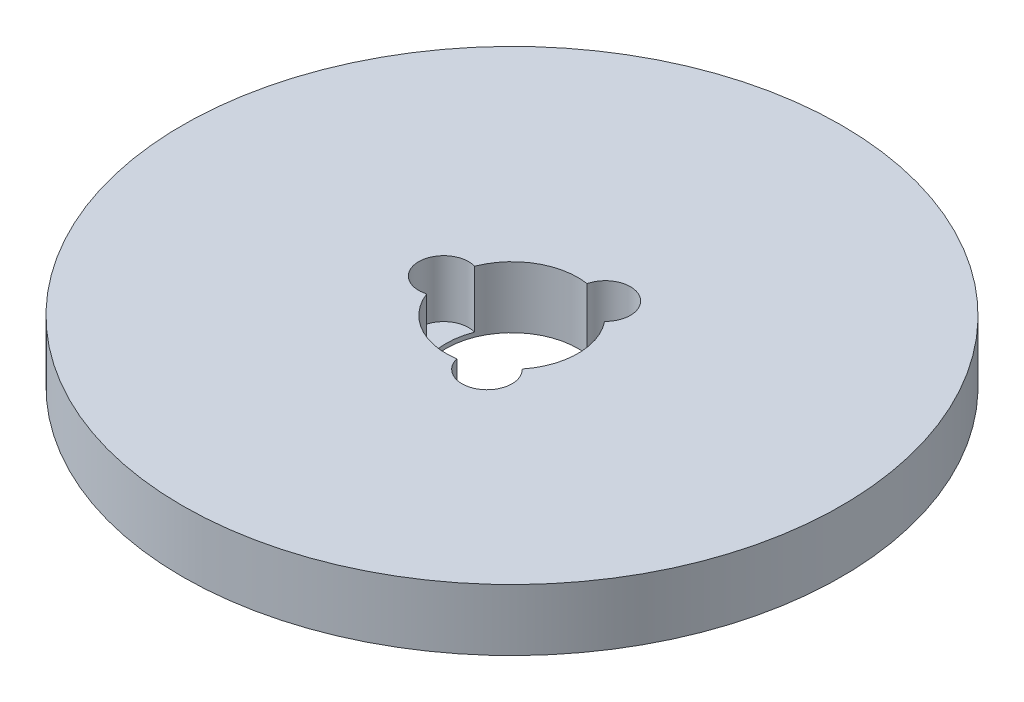
from build123d import *

# Parameters (mm, degrees)
SKETCH1_R           = 75
BOSS_EXTRUDE1_DEPTH = 14
SKETCH2_R           = 15
CUT_EXTRUDE1_DEPTH  = 107.98598039
SKETCH3_R           = 5.682831188
CUT_EXTRUDE2_DEPTH  = 12.998677968
CIRPATTERN1_COUNT   = 3


with BuildPart() as part:
    # Sketch1 → Boss-Extrude1 (new body)
    with BuildSketch(Plane(origin=(0, 0, 0), x_dir=(1, 0, 0), z_dir=(0, 1, 0))):
        Circle(SKETCH1_R)
    extrude(amount=BOSS_EXTRUDE1_DEPTH)

    # Sketch2 → Cut-Extrude1 (cut, through all)
    with BuildSketch(Plane(origin=(0, 0, 0), x_dir=(1, 0, 0), z_dir=(0, 1, 0))):
        Circle(SKETCH2_R)
    extrude(amount=CUT_EXTRUDE1_DEPTH, mode=Mode.SUBTRACT)

    # Sketch3 → Cut-Extrude2 (cut)
    with BuildSketch(Plane(origin=(0, 14, 0), x_dir=(1, 0, 0), z_dir=(0, 1, 0))):
        with Locations((-15.55178737, 0)):
            Circle(SKETCH3_R)
    cut_extrude2 = extrude(amount=-CUT_EXTRUDE2_DEPTH, mode=Mode.SUBTRACT)

    # CirPattern1: Cut-Extrude2 ×3 about axis
    cirpattern1_axis = Axis((0, 0, 0), (0, 1, 0))
    for i in range(1, CIRPATTERN1_COUNT):
        add(cut_extrude2.rotate(cirpattern1_axis, i * 360 / CIRPATTERN1_COUNT), mode=Mode.SUBTRACT)


solid = part.part
